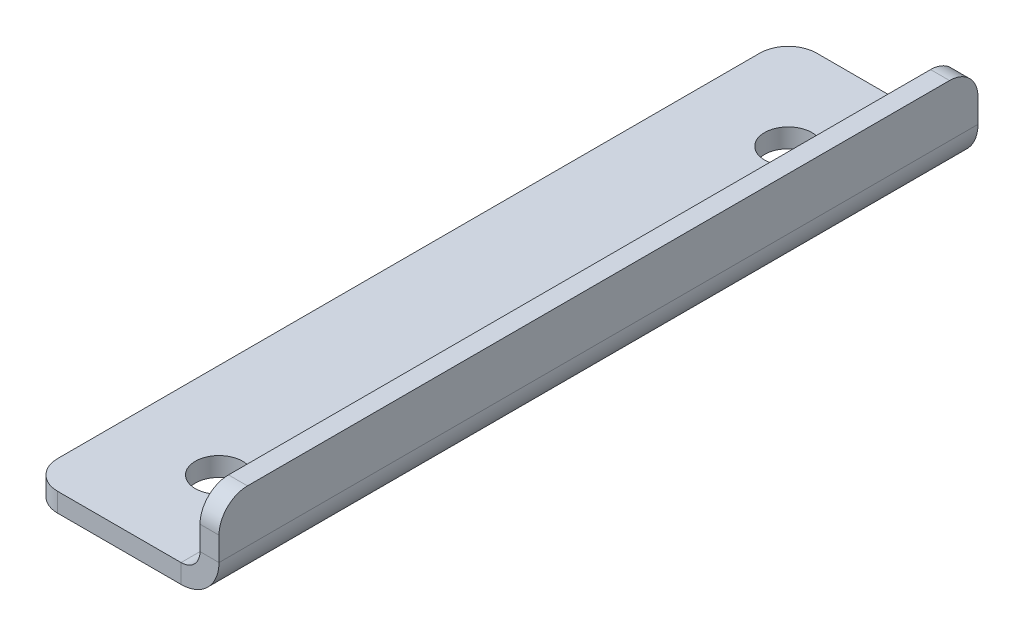
from build123d import *

# Parameters (mm, degrees)
SKETCH1_W                    = 20
SKETCH1_H                    = 80
BASE_FLANGE1_DEPTH           = 2
EDGE_FLANGE1_STRIP_W         = 12
EDGE_FLANGE1_STRIP_H         = 2
EDGE_FLANGE1_STRIP_CUT_DEPTH = 80
EDGE_FLANGE1_DEPTH           = 80
F_5_0MM_DOWEL_HOLE1_D        = 5
FILLET1_R                    = 3


# Sheet-metal steps are written as plain solids
with BuildPart() as part:
    # Sketch1 → Base-Flange1 (new body)
    with BuildSketch(Plane(origin=(0, 0, 0), x_dir=(1, 0, 0), z_dir=(0, 1, 0))):
        Rectangle(SKETCH1_W, SKETCH1_H)
    extrude(amount=BASE_FLANGE1_DEPTH)

    # Edge-Flange1 strip (across the edge) → Edge-Flange1 strip cut (cut)
    with BuildSketch(Plane(origin=(10, 2, 40), x_dir=(-1, 0, 0), z_dir=(0, 0, -1))):
        with Locations((-2, -1)):
            Rectangle(EDGE_FLANGE1_STRIP_W, EDGE_FLANGE1_STRIP_H)
    extrude(amount=EDGE_FLANGE1_STRIP_CUT_DEPTH, mode=Mode.SUBTRACT)

    # Edge-Flange1 section (across the edge) → Edge-Flange1 (add)
    with BuildSketch(Plane(origin=(10, 2, 40), x_dir=(-1, 0, 0), z_dir=(0, 0, -1))):
        with BuildLine():
            Line((0, 2), (0, 7.5))
            Line((0, 7.5), (2, 7.5))
            Line((2, 7.5), (2, 2))
            ThreePointArc((2, 2), (2.585786438, 0.585786438), (4, 0))
            Line((4, 0), (4, -2))
            ThreePointArc((4, -2), (1.171572875, -0.828427125), (0, 2))
        make_face()
    extrude(amount=EDGE_FLANGE1_DEPTH)

    # Ø5.0mm Dowel Hole1 (through all)
    with Locations(Plane(origin=(0, 2, 0), x_dir=(1, 0, 0), z_dir=(0, 1, 0))):
        with Locations((0, 30), (0, -30)):
            Hole(F_5_0MM_DOWEL_HOLE1_D / 2)

    # Fillet1
    fillet1_edges = [part.edges().sort_by_distance(p)[0] for p in [
        (9, 9.5, 40),
        (9, 9.5, -40),
        (-10, 1, -40),
        (-10, 1, 40),
    ]]
    fillet(fillet1_edges, radius=FILLET1_R)


solid = part.part
